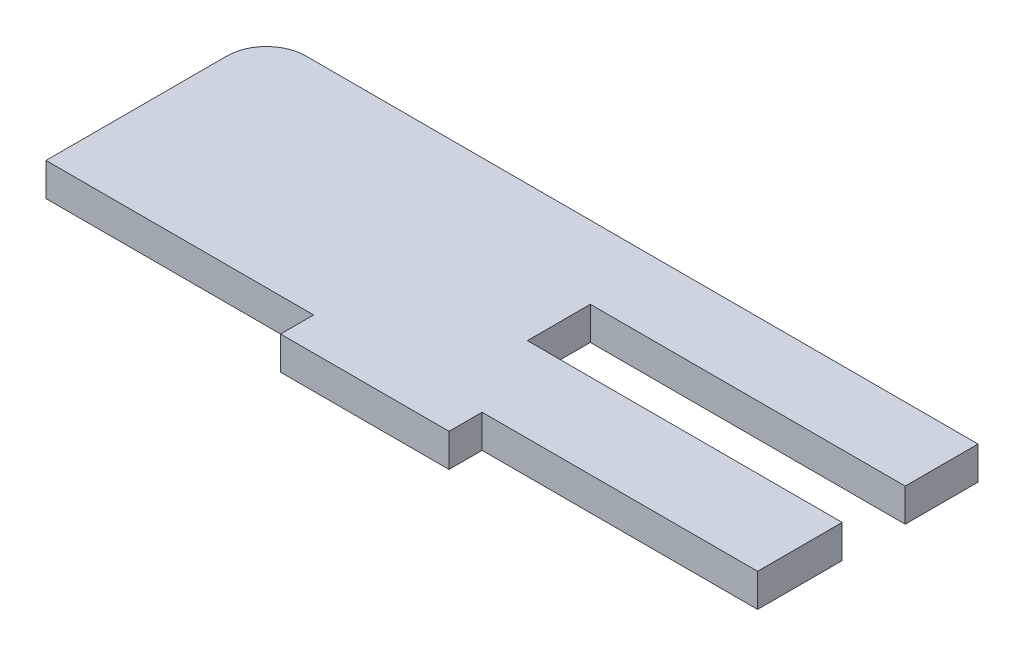
from build123d import *

# Parameters (mm, degrees)
SKETCH1_W           = 114.808
SKETCH1_H           = 40.894
BOSS_EXTRUDE1_DEPTH = 5.334
FILLET1_R           = 6.35
SKETCH3_W           = 43.18
SKETCH3_H           = 5.334
SKETCH3_W_2         = 44.45
CUT_EXTRUDE2_DEPTH  = 474.106416887
SKETCH4_W           = 50.8
SKETCH4_H           = 10.16
CUT_EXTRUDE3_DEPTH  = 474.106416887


with BuildPart() as part:
    # Sketch1 → Boss-Extrude1 (new body)
    with BuildSketch(Plane(origin=(0, 0, 0), x_dir=(1, 0, 0), z_dir=(0, 1, 0))):
        with Locations((-373.645654051, 174.482284322)):
            Rectangle(SKETCH1_W, SKETCH1_H)
    extrude(amount=BOSS_EXTRUDE1_DEPTH)

    # Fillet1
    fillet1_edges = [part.edges().sort_by_distance(p)[0] for p in [
        (-431.049654051, 2.667, -194.929284322),
    ]]
    fillet(fillet1_edges, radius=FILLET1_R)

    # Sketch3 → Cut-Extrude2 (cut, through all)
    with BuildSketch(Plane(origin=(0, 5.334, 0), x_dir=(1, 0, 0), z_dir=(0, 1, 0))):
        with Locations((-409.459654051, 156.702284322)):
            Rectangle(SKETCH3_W, SKETCH3_H)
        with Locations((-338.466654051, 156.702284322)):
            Rectangle(SKETCH3_W_2, SKETCH3_H)
    extrude(amount=-CUT_EXTRUDE2_DEPTH, mode=Mode.SUBTRACT)

    # Sketch4 → Cut-Extrude3 (cut, through all)
    with BuildSketch(Plane(origin=(0, 0, 0), x_dir=(-1, 0, 0), z_dir=(0, -1, 0))):
        with Locations((341.641654051, 178.102349914)):
            Rectangle(SKETCH4_W, SKETCH4_H)
    extrude(amount=-CUT_EXTRUDE3_DEPTH, mode=Mode.SUBTRACT)


solid = part.part
